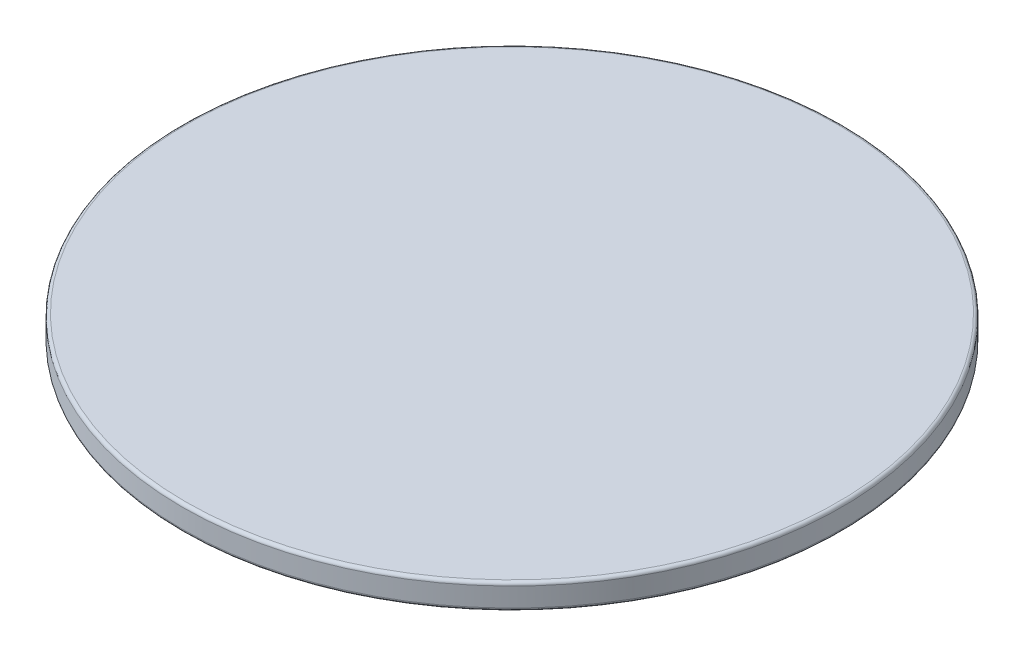
from build123d import *

# Parameters (mm, degrees)
SKETCH2_R           = 66.04
BOSS_EXTRUDE1_DEPTH = 5.08
FILLET1_R           = 0.635


with BuildPart() as part:
    # Sketch2 → Boss-Extrude1 (new body)
    with BuildSketch(Plane(origin=(0, 0, 0), x_dir=(1, 0, 0), z_dir=(0, 1, 0))):
        Circle(SKETCH2_R)
    extrude(amount=BOSS_EXTRUDE1_DEPTH)

    # Fillet1
    fillet1_edges = [part.edges().sort_by_distance(p)[0] for p in [
        (-66.04, 0, 0),
        (-66.04, 5.08, 0),
    ]]
    fillet(fillet1_edges, radius=FILLET1_R)


solid = part.part
